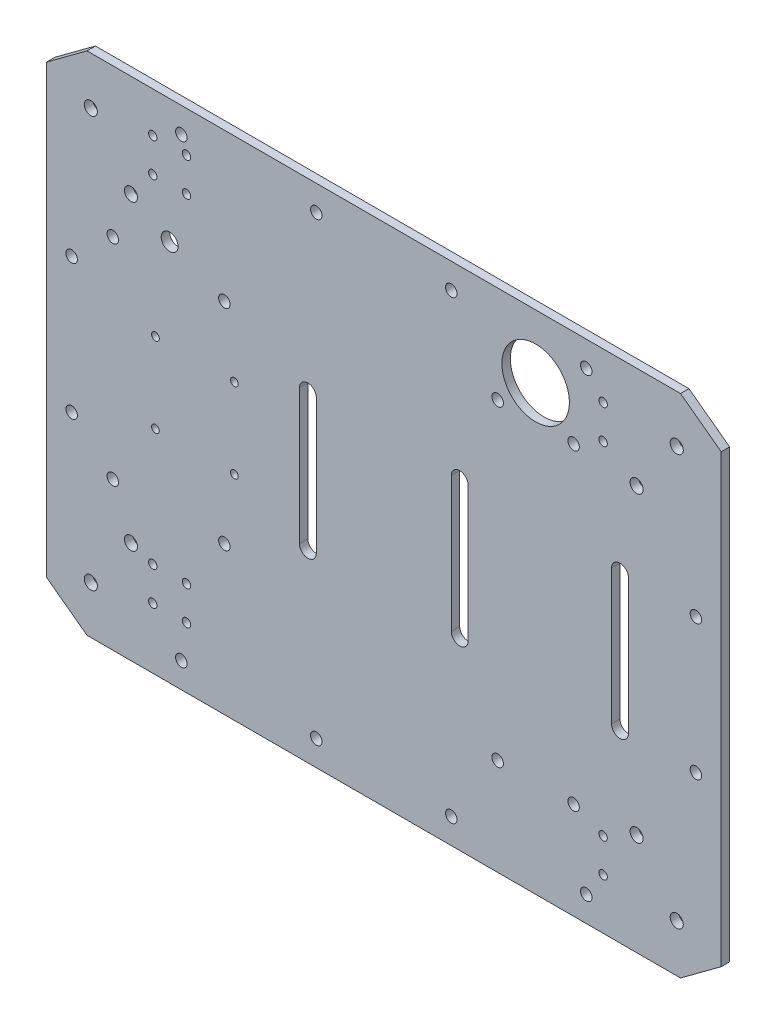
from build123d import *

# Parameters (mm, degrees)
SKETCH1_R           = 2.4638
BOSS_EXTRUDE1_DEPTH = 3.175
SKETCH2_R           = 2.159
CUT_EXTRUDE1_DEPTH  = 159.781746826
SKETCH5_R           = 3.175
SKETCH5_R_2         = 12.7
SKETCH5_R_3         = 1.5875
SKETCH5_R_4         = 2.159
SKETCH5_R_5         = 1.4478
CUT_EXTRUDE2_DEPTH  = 159.781746826
SKETCH6_R           = 2.159
CUT_EXTRUDE3_DEPTH  = 159.781746826


with BuildPart() as part:
    # Sketch1 → Boss-Extrude1 (new body)
    with BuildSketch(Plane.XY):
        Polygon((-111.686526805, -95.25), (-127, -83.918625912), (-127, 83.918625912), (-111.686526805, 95.25), (111.686526805, 95.25), (127, 83.918625912), (127, -83.918625912), (111.686526805, -95.25), align=None)
        with Locations((-95.147512794, 56.885632681)):
            Circle(SKETCH1_R, mode=Mode.SUBTRACT)
        with Locations((-110.256011578, 77.303596941)):
            Circle(SKETCH1_R, mode=Mode.SUBTRACT)
        with Locations((110.256011578, 77.303596941)):
            Circle(SKETCH1_R, mode=Mode.SUBTRACT)
        with Locations((95.147512794, 56.885632681)):
            Circle(SKETCH1_R, mode=Mode.SUBTRACT)
        with Locations((-110.256011578, -77.303596941)):
            Circle(SKETCH1_R, mode=Mode.SUBTRACT)
        with Locations((-95.147512794, -56.885632681)):
            Circle(SKETCH1_R, mode=Mode.SUBTRACT)
        with Locations((110.256011578, -77.303596941)):
            Circle(SKETCH1_R, mode=Mode.SUBTRACT)
        with Locations((95.147512794, -56.885632681)):
            Circle(SKETCH1_R, mode=Mode.SUBTRACT)
    extrude(amount=BOSS_EXTRUDE1_DEPTH)

    # Sketch2 → Cut-Extrude1 (cut, through all)
    with BuildSketch(Plane.XY.offset(3.175)):
        with Locations((42.8625, 58.7375)):
            Circle(SKETCH2_R)
        with Locations((42.8625, -58.7375)):
            Circle(SKETCH2_R)
        with Locations((71.4375, -58.7375)):
            Circle(SKETCH2_R)
        with Locations((71.4375, 58.7375)):
            Circle(SKETCH2_R)
    extrude(amount=-CUT_EXTRUDE1_DEPTH, mode=Mode.SUBTRACT)

    # Sketch5 → Cut-Extrude2 (cut, through all)
    with BuildSketch(Plane(origin=(0, 0, 0), x_dir=(-1, 0, 0), z_dir=(0, 0, -1))):
        with BuildLine():
            Line((-85.725, -25.4), (-85.725, 25.4))
            ThreePointArc((-85.725, 25.4), (-88.9, 28.575), (-92.075, 25.4))
            Line((-92.075, 25.4), (-92.075, -25.4))
            ThreePointArc((-92.075, -25.4), (-88.9, -28.575), (-85.725, -25.4))
        make_face()
        with BuildLine():
            Line((-25.4, -25.4), (-25.4, 25.4))
            ThreePointArc((-25.4, 25.4), (-28.575, 28.575), (-31.75, 25.4))
            Line((-31.75, 25.4), (-31.75, -25.4))
            ThreePointArc((-31.75, -25.4), (-28.575, -28.575), (-25.4, -25.4))
        make_face()
        with BuildLine():
            ThreePointArc((31.75, 25.4), (28.575, 28.575), (25.4, 25.4))
            Line((25.4, 25.4), (25.4, -25.4))
            ThreePointArc((25.4, -25.4), (28.575, -28.575), (31.75, -25.4))
            Line((31.75, -25.4), (31.75, 25.4))
        make_face()
        with Locations((80.594630637, 48.58004)):
            Circle(SKETCH5_R)
        with Locations((-57.15, 71.4375)):
            Circle(SKETCH5_R_2)
        with Locations((74.244630637, 67.31)):
            Circle(SKETCH5_R_3)
        with Locations((74.244630637, 80.01)):
            Circle(SKETCH5_R_3)
        with Locations((74.244630637, -72.39)):
            Circle(SKETCH5_R_3)
        with Locations((74.244630637, -59.69)):
            Circle(SKETCH5_R_3)
        with Locations((86.944630637, -72.39)):
            Circle(SKETCH5_R_3)
        with Locations((86.944630637, -59.69)):
            Circle(SKETCH5_R_3)
        with Locations((86.944630637, 80.01)):
            Circle(SKETCH5_R_3)
        with Locations((86.944630637, 67.31)):
            Circle(SKETCH5_R_3)
        with Locations((59.995230637, 39.49954)):
            Circle(SKETCH5_R_4)
        with Locations((101.994130637, 39.49954)):
            Circle(SKETCH5_R_4)
        with Locations((59.995230637, -39.49954)):
            Circle(SKETCH5_R_4)
        with Locations((101.994130637, -39.49954)):
            Circle(SKETCH5_R_4)
        with Locations((-82.55, -63.482384126)):
            Circle(SKETCH5_R_3)
        with Locations((-82.55, -76.182384126)):
            Circle(SKETCH5_R_3)
        with Locations((-82.55, 77.7875)):
            Circle(SKETCH5_R_3)
        with Locations((-82.55, 65.0875)):
            Circle(SKETCH5_R_3)
        with Locations((56.219708857, 15.03413)):
            Circle(SKETCH5_R_5)
        with Locations((56.219708857, -15.03413)):
            Circle(SKETCH5_R_5)
        with Locations((85.937708857, -15.03413)):
            Circle(SKETCH5_R_5)
        with Locations((85.937708857, 15.03413)):
            Circle(SKETCH5_R_5)
    extrude(amount=-CUT_EXTRUDE2_DEPTH, mode=Mode.SUBTRACT)

    # Sketch6 → Cut-Extrude3 (cut, through all)
    with BuildSketch(Plane(origin=(0, 0, 0), x_dir=(-1, 0, 0), z_dir=(0, 0, -1))):
        with Locations((-76.2, -85.725)):
            Circle(SKETCH6_R)
        with Locations((-25.4, -85.725)):
            Circle(SKETCH6_R)
        with Locations((25.4, -85.725)):
            Circle(SKETCH6_R)
        with Locations((76.2, -85.725)):
            Circle(SKETCH6_R)
        with Locations((76.2, 85.725)):
            Circle(SKETCH6_R)
        with Locations((25.4, 85.725)):
            Circle(SKETCH6_R)
        with Locations((-25.4, 85.725)):
            Circle(SKETCH6_R)
        with Locations((-76.2, 85.725)):
            Circle(SKETCH6_R)
        with Locations((117.475, -25.4)):
            Circle(SKETCH6_R)
        with Locations((117.475, 25.4)):
            Circle(SKETCH6_R)
        with Locations((-117.475, 25.4)):
            Circle(SKETCH6_R)
        with Locations((-117.475, -25.4)):
            Circle(SKETCH6_R)
    extrude(amount=-CUT_EXTRUDE3_DEPTH, mode=Mode.SUBTRACT)


solid = part.part
